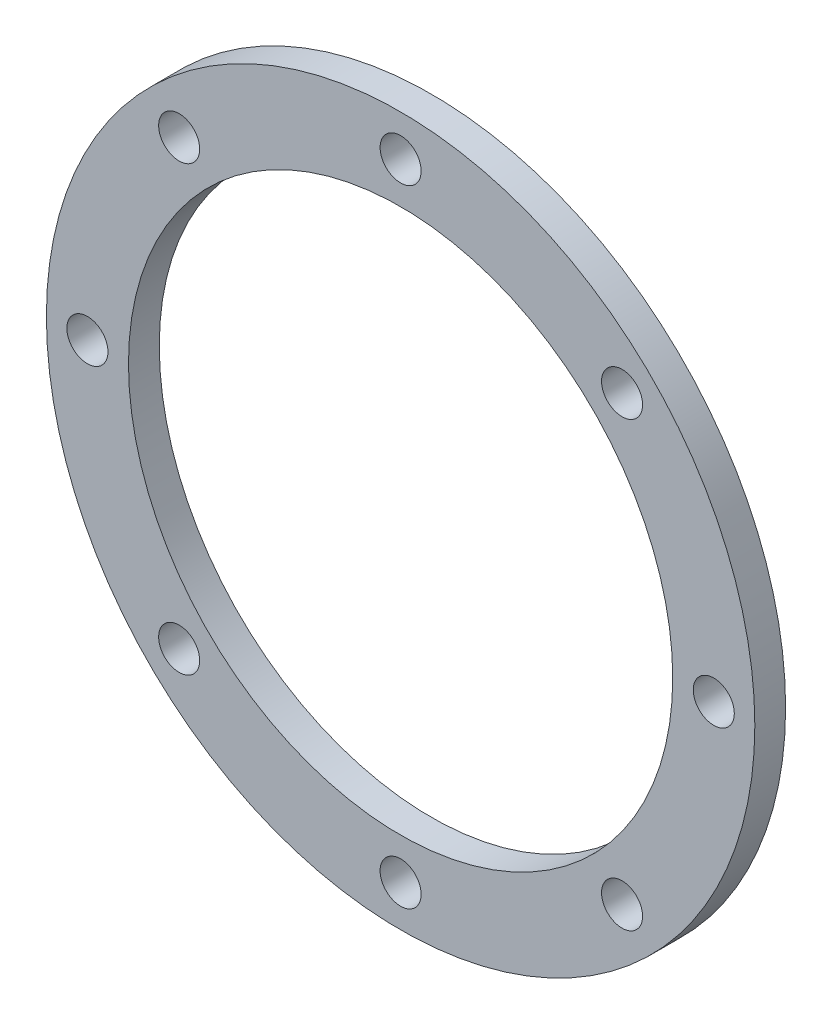
from build123d import *

# Parameters (mm, degrees)
SKETCH1_R         = 109.601
SKETCH1_R_2       = 84.201
EXTRUDE1_DEPTH    = 9.525
CIRPATTERN1_COUNT = 8


with BuildPart() as part:
    # Sketch1 → Extrude1 (new body)
    with BuildSketch(Plane.XY):
        Circle(SKETCH1_R)
        Circle(SKETCH1_R_2, mode=Mode.SUBTRACT)
    extrude(amount=EXTRUDE1_DEPTH)

    # Sketch2 → 1/2 (0.5) Diameter Hole3 (revolve, cut)
    with BuildSketch(Plane(origin=(0, 96.901, 9.525), x_dir=(0, -1, 0), z_dir=(1, 0, 0))):
        Polygon((0, 0), (0, 29.215464931), (6.35, 25.4), (6.35, 0), align=None)
    f_1_2_0_5_diameter_hole3 = revolve(axis=Axis((0, 96.901, 15.875), (0, 0, -1)), mode=Mode.SUBTRACT)

    # CirPattern1: 1/2 (0.5) Diameter Hole3 ×8 about axis
    cirpattern1_axis = Axis((0, 0, 9.525), (0, 0, -1))
    for i in range(1, CIRPATTERN1_COUNT):
        add(f_1_2_0_5_diameter_hole3.rotate(cirpattern1_axis, i * 360 / CIRPATTERN1_COUNT), mode=Mode.SUBTRACT)


solid = part.part
